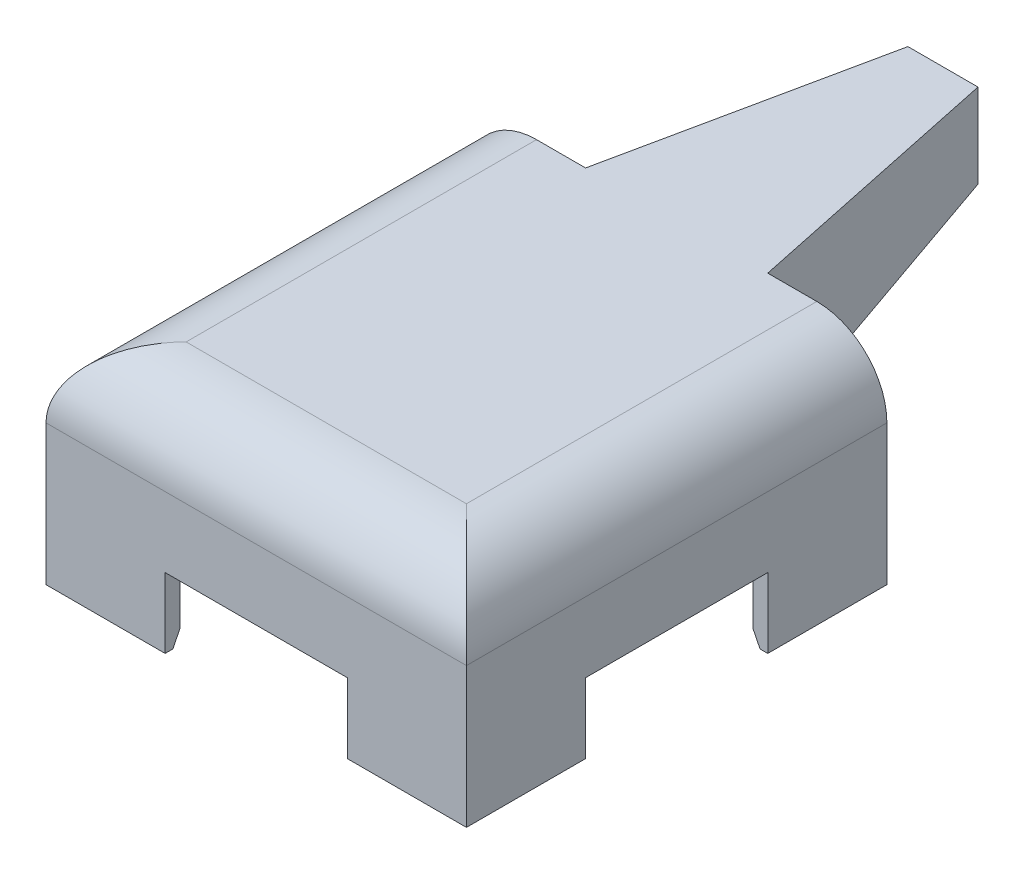
from build123d import *
from OCP.BRepFilletAPI import BRepFilletAPI_MakeChamfer

# Parameters (mm, degrees)
SKETCH1_W           = 76.2
SKETCH1_H           = 76.2
BOSS_EXTRUDE1_DEPTH = 25.4
SKETCH2_W           = 57.15
SKETCH2_H           = 57.15
CUT_EXTRUDE1_DEPTH  = 19.05
BOSS_EXTRUDE2_DEPTH = 12.7
CHAMFER1_SIZE       = 2.54
CHAMFER1_SIZE2      = 1.27
FILLET1_R           = 12.7
SKETCH4_W           = 33.02
SKETCH4_H           = 25.4
BOSS_EXTRUDE3_DEPTH = 48.26
CHAMFER2_SIZE       = 48.26
CHAMFER2_SIZE_2     = 10.16


with BuildPart() as part:
    # Sketch1 → Boss-Extrude1 (new body)
    with BuildSketch(Plane(origin=(0, 1478.617106037, 0), x_dir=(1, 0, 0), z_dir=(0, 1, 0))):
        with Locations((-492.049198231, -806.92955637)):
            Rectangle(SKETCH1_W, SKETCH1_H)
    extrude(amount=BOSS_EXTRUDE1_DEPTH)

    # Sketch2 → Cut-Extrude1 (cut)
    with BuildSketch(Plane(origin=(0, 1478.617106037, 0), x_dir=(-1, 0, 0), z_dir=(0, -1, 0))):
        with Locations((492.049198231, -806.92955637)):
            Rectangle(SKETCH2_W, SKETCH2_H)
    extrude(amount=-CUT_EXTRUDE1_DEPTH, mode=Mode.SUBTRACT)

    # Sketch3 → Boss-Extrude2 (add)
    with BuildSketch(Plane(origin=(0, 1478.617106037, 0), x_dir=(-1, 0, 0), z_dir=(0, -1, 0))):
        Polygon((530.149198231, -790.41955637), (527.482198231, -790.41955637), (527.482198231, -771.49655637), (508.559198231, -771.49655637), (508.559198231, -768.82955637), (530.149198231, -768.82955637), align=None)
        Polygon((530.149198231, -823.43955637), (527.482198231, -823.43955637), (527.482198231, -842.36255637), (508.559198231, -842.36255637), (508.559198231, -845.02955637), (530.149198231, -845.02955637), align=None)
        Polygon((475.539198231, -768.82955637), (475.539198231, -771.49655637), (456.616198231, -771.49655637), (456.616198231, -790.41955637), (453.949198231, -790.41955637), (453.949198231, -768.82955637), align=None)
        Polygon((475.539198231, -845.02955637), (475.539198231, -842.36255637), (456.616198231, -842.36255637), (456.616198231, -823.43955637), (453.949198231, -823.43955637), (453.949198231, -845.02955637), align=None)
    extrude(amount=BOSS_EXTRUDE2_DEPTH)

    # Chamfer1: one chamfer whose edges measure the first distance from different faces: ONE call of the kernel's chamfer builder (chamfer() names one face for all edges)
    chamfer1_edges_1 = [part.edges().sort_by_distance(p)[0] for p in [
        (-518.020698231, 1465.917106037, 771.49655637),
    ]]
    chamfer1_side_1 = [part.faces().sort_by_distance(p)[0] for p in [
        (-518.020698231, 1472.267106037, 771.49655637),
    ]]
    chamfer1_edges_2 = [part.edges().sort_by_distance(p)[0] for p in [
        (-527.482198231, 1465.917106037, 780.95805637),
    ]]
    chamfer1_side_2 = [part.faces().sort_by_distance(p)[0] for p in [
        (-527.482198231, 1472.267106037, 780.95805637),
    ]]
    chamfer1_edges_3 = [part.edges().sort_by_distance(p)[0] for p in [
        (-527.482198231, 1465.917106037, 832.90105637),
    ]]
    chamfer1_side_3 = [part.faces().sort_by_distance(p)[0] for p in [
        (-527.482198231, 1472.267106037, 832.90105637),
    ]]
    chamfer1_edges_4 = [part.edges().sort_by_distance(p)[0] for p in [
        (-518.020698231, 1465.917106037, 842.36255637),
    ]]
    chamfer1_side_4 = [part.faces().sort_by_distance(p)[0] for p in [
        (-518.020698231, 1472.267106037, 842.36255637),
    ]]
    chamfer1_edges_5 = [part.edges().sort_by_distance(p)[0] for p in [
        (-466.077698231, 1465.917106037, 771.49655637),
    ]]
    chamfer1_side_5 = [part.faces().sort_by_distance(p)[0] for p in [
        (-466.077698231, 1472.267106037, 771.49655637),
    ]]
    chamfer1_edges_6 = [part.edges().sort_by_distance(p)[0] for p in [
        (-456.616198231, 1465.917106037, 780.95805637),
    ]]
    chamfer1_side_6 = [part.faces().sort_by_distance(p)[0] for p in [
        (-456.616198231, 1472.267106037, 780.95805637),
    ]]
    chamfer1_edges_7 = [part.edges().sort_by_distance(p)[0] for p in [
        (-466.077698231, 1465.917106037, 842.36255637),
    ]]
    chamfer1_side_7 = [part.faces().sort_by_distance(p)[0] for p in [
        (-466.077698231, 1472.267106037, 842.36255637),
    ]]
    chamfer1_edges_8 = [part.edges().sort_by_distance(p)[0] for p in [
        (-456.616198231, 1465.917106037, 832.90105637),
    ]]
    chamfer1_side_8 = [part.faces().sort_by_distance(p)[0] for p in [
        (-456.616198231, 1472.267106037, 832.90105637),
    ]]
    chamfer1 = BRepFilletAPI_MakeChamfer(part.part.solid().wrapped)
    for e in chamfer1_edges_1:
        chamfer1.Add(CHAMFER1_SIZE, CHAMFER1_SIZE2, e.wrapped, chamfer1_side_1[0].wrapped)  # the first distance lies on this face
    for e in chamfer1_edges_2:
        chamfer1.Add(CHAMFER1_SIZE, CHAMFER1_SIZE2, e.wrapped, chamfer1_side_2[0].wrapped)  # the first distance lies on this face
    for e in chamfer1_edges_3:
        chamfer1.Add(CHAMFER1_SIZE, CHAMFER1_SIZE2, e.wrapped, chamfer1_side_3[0].wrapped)  # the first distance lies on this face
    for e in chamfer1_edges_4:
        chamfer1.Add(CHAMFER1_SIZE, CHAMFER1_SIZE2, e.wrapped, chamfer1_side_4[0].wrapped)  # the first distance lies on this face
    for e in chamfer1_edges_5:
        chamfer1.Add(CHAMFER1_SIZE, CHAMFER1_SIZE2, e.wrapped, chamfer1_side_5[0].wrapped)  # the first distance lies on this face
    for e in chamfer1_edges_6:
        chamfer1.Add(CHAMFER1_SIZE, CHAMFER1_SIZE2, e.wrapped, chamfer1_side_6[0].wrapped)  # the first distance lies on this face
    for e in chamfer1_edges_7:
        chamfer1.Add(CHAMFER1_SIZE, CHAMFER1_SIZE2, e.wrapped, chamfer1_side_7[0].wrapped)  # the first distance lies on this face
    for e in chamfer1_edges_8:
        chamfer1.Add(CHAMFER1_SIZE, CHAMFER1_SIZE2, e.wrapped, chamfer1_side_8[0].wrapped)  # the first distance lies on this face
    add(Compound.cast(chamfer1.Shape()), mode=Mode.REPLACE)

    # Fillet1
    fillet1_edges = [part.edges().sort_by_distance(p)[0] for p in [
        (-530.149198231, 1504.017106037, 806.92955637),
        (-492.049198231, 1504.017106037, 845.02955637),
        (-453.949198231, 1504.017106037, 806.92955637),
    ]]
    fillet(fillet1_edges, radius=FILLET1_R)

    # Sketch4 → Boss-Extrude3 (add)
    with BuildSketch(Plane(origin=(0, 0, 768.82955637), x_dir=(-1, 0, 0), z_dir=(0, 0, -1))):
        with Locations((492.049198231, 1491.317106037)):
            Rectangle(SKETCH4_W, SKETCH4_H)
    extrude(amount=BOSS_EXTRUDE3_DEPTH)

    # Chamfer2
    # the kernel refuses this chamfer: 48.26, 10.16 mm, written as the material it takes off along each edge
    with BuildSketch(Plane(origin=(-508.559198231, 1353.240682796, 720.56955637), x_dir=(-0.007929773045437122, 0, 0.9999685588554512), z_dir=(0, 1, 0))) as chamfer2_piece_1_section:
        Polygon((CHAMFER2_SIZE * 0.999968558855, CHAMFER2_SIZE * 0.00792977304544), (-CHAMFER2_SIZE_2 * 0.00792977304544, CHAMFER2_SIZE_2 * 0.999968558855), (0, 0), align=None)
    chamfer2_piece_1 = extrude(amount=276.152846481, mode=Mode.PRIVATE)
    chamfer2_piece_1 = split(chamfer2_piece_1, bisect_by=Plane(origin=(-505.671976228, 1491.317106037, 768.82955637), z_dir=(0, 0, -1)), keep=Keep.TOP, mode=Mode.PRIVATE)
    add(chamfer2_piece_1, mode=Mode.SUBTRACT)
    with BuildSketch(Plane(origin=(-350.16277499, 1478.617106037, 720.56955637), x_dir=(0, -0.007929773045437122, 0.9999685588554512), z_dir=(-1, 0, 0))) as chamfer2_piece_2:
        Polygon((CHAMFER2_SIZE * 0.999968558855, CHAMFER2_SIZE * 0.00792977304544), (-CHAMFER2_SIZE_2 * 0.00792977304544, CHAMFER2_SIZE_2 * 0.999968558855), (0, 0), align=None)
    extrude(amount=283.772846481, mode=Mode.SUBTRACT)
    with BuildSketch(Plane(origin=(-475.539198231, 1629.393529277, 720.56955637), x_dir=(0.007929773045437122, 0, 0.9999685588554512), z_dir=(0, -1, 0))) as chamfer2_piece_3_section:
        Polygon((CHAMFER2_SIZE * 0.999968558855, CHAMFER2_SIZE * 0.00792977304544), (-CHAMFER2_SIZE_2 * 0.00792977304544, CHAMFER2_SIZE_2 * 0.999968558855), (0, 0), align=None)
    chamfer2_piece_3 = extrude(amount=276.152846481, mode=Mode.PRIVATE)
    chamfer2_piece_3 = split(chamfer2_piece_3, bisect_by=Plane(origin=(-478.426420234, 1491.317106037, 768.82955637), z_dir=(0, 0, -1)), keep=Keep.TOP, mode=Mode.PRIVATE)
    add(chamfer2_piece_3, mode=Mode.SUBTRACT)


solid = part.part
